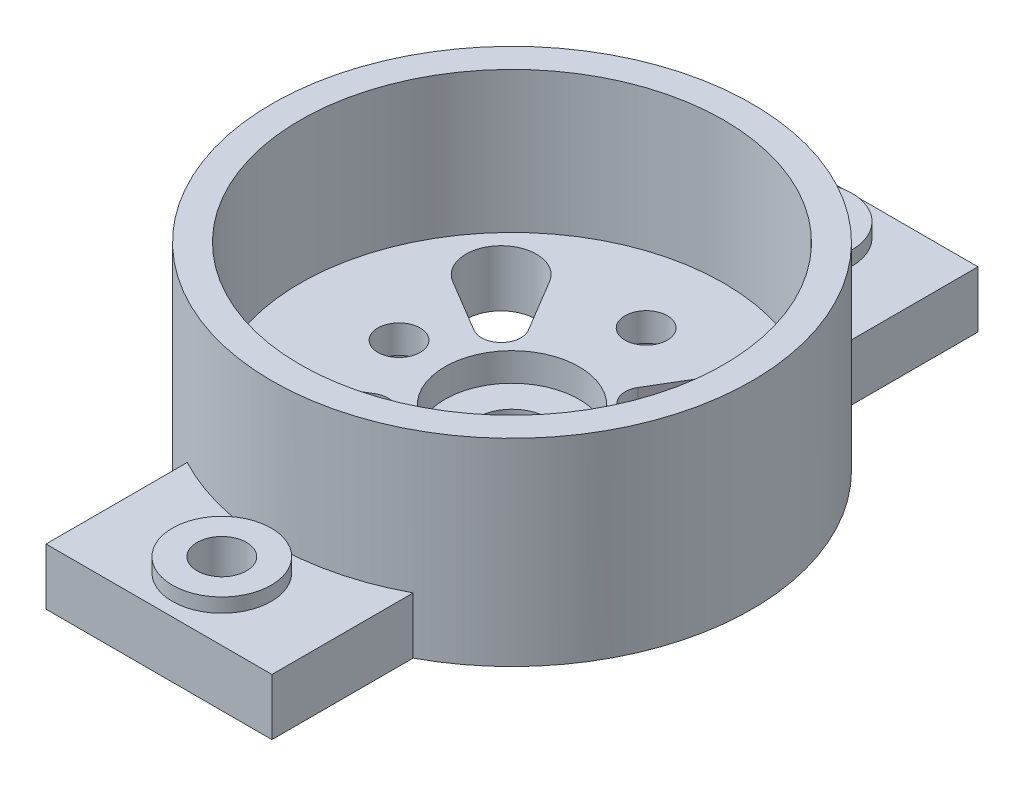
from build123d import *

# Parameters (mm, degrees)
ESTRUSIONE_ESTRUSIONE1_DEPTH = 4
SCHIZZO2_R                   = 17
SCHIZZO2_R_2                 = 15
ESTRUSIONE_ESTRUSIONE2_DEPTH = 10
SCHIZZO3_R                   = 2.5
SCHIZZO3_R_2                 = 1.5
TAGLIO_ESTRUSIONE1_DEPTH     = 32.843366656
SCHIZZO4_R                   = 4.75
TAGLIO_ESTRUSIONE2_DEPTH     = 2
SCHIZZO5_R                   = 2.5
TAGLIO_ESTRUSIONE3_DEPTH     = 2
SCHIZZO6_R                   = 3.5
ESTRUSIONE_ESTRUSIONE8_DEPTH = 1
SCHIZZO7_R                   = 1.75
TAGLIO_ESTRUSIONE4_DEPTH     = 32.543620591


with BuildPart() as part:
    # Schizzo1 → Estrusione-Estrusione1 (new body)
    with BuildSketch(Plane(origin=(0, 0, 0), x_dir=(1, 0, 0), z_dir=(0, 1, 0))):
        with BuildLine():
            Line((8, 25), (-8, 25))
            Line((-8, 25), (-8, 15))
            ThreePointArc((-8, 15), (-17, 0), (-8, -15))
            Line((-8, -15), (-8, -25))
            Line((-8, -25), (8, -25))
            Line((8, -25), (8, -15))
            ThreePointArc((8, -15), (17, 0), (8, 15))
            Line((8, 15), (8, 25))
        make_face()
    extrude(amount=ESTRUSIONE_ESTRUSIONE1_DEPTH)

    # Schizzo2 → Estrusione-Estrusione2 (add)
    with BuildSketch(Plane(origin=(0, 4, 0), x_dir=(1, 0, 0), z_dir=(0, 1, 0))):
        Circle(SCHIZZO2_R)
        Circle(SCHIZZO2_R_2, mode=Mode.SUBTRACT)
    extrude(amount=ESTRUSIONE_ESTRUSIONE2_DEPTH)

    # Schizzo3 → Taglio-Estrusione1 (cut, through all)
    with BuildSketch(Plane(origin=(0, 4, 0), x_dir=(1, 0, 0), z_dir=(0, 1, 0))):
        Circle(SCHIZZO3_R)
        with Locations((8, 0)):
            Circle(SCHIZZO3_R_2)
        with Locations((0, 9.5)):
            Circle(SCHIZZO3_R_2)
        with Locations((-8, 0)):
            Circle(SCHIZZO3_R_2)
        with Locations((0, -9.5)):
            Circle(SCHIZZO3_R_2)
        with BuildLine():
            Line((3.747842122, -5.667677506), (5.985468437, -9.413745909))
            ThreePointArc((5.985468437, -9.413745909), (9.899494937, -9.899494937), (9.413745909, -5.985468437))
            Line((9.413745909, -5.985468437), (5.667677506, -3.747842122))
            ThreePointArc((5.667677506, -3.747842122), (3.959797975, -3.959797975), (3.747842122, -5.667677506))
        make_face()
        with BuildLine():
            Line((-3.644139728, -6.051509987), (-5.881766043, -9.797578389))
            ThreePointArc((-5.881766043, -9.797578389), (-9.795792543, -10.283327417), (-9.310043515, -6.369300918))
            Line((-9.310043515, -6.369300918), (-5.563975112, -4.131674603))
            ThreePointArc((-5.563975112, -4.131674603), (-3.856095581, -4.343630455), (-3.644139728, -6.051509987))
        make_face()
        with BuildLine():
            Line((-5.947807593, 3.260307248), (-9.693875995, 5.497933563))
            ThreePointArc((-9.693875995, 5.497933563), (-10.179625023, 9.411960062), (-6.265598524, 8.926211034))
            Line((-6.265598524, 8.926211034), (-4.027972209, 5.180142632))
            ThreePointArc((-4.027972209, 5.180142632), (-4.239928061, 3.4722631), (-5.947807593, 3.260307248))
        make_face()
        with BuildLine():
            Line((3.364009642, 5.563975112), (5.601635957, 9.310043515))
            ThreePointArc((5.601635957, 9.310043515), (9.515662456, 9.795792543), (9.029913428, 5.881766043))
            Line((9.029913428, 5.881766043), (5.283845026, 3.644139728))
            ThreePointArc((5.283845026, 3.644139728), (3.575965494, 3.856095581), (3.364009642, 5.563975112))
        make_face()
    extrude(amount=-TAGLIO_ESTRUSIONE1_DEPTH, mode=Mode.SUBTRACT)

    # Schizzo4 → Taglio-Estrusione2 (cut)
    with BuildSketch(Plane(origin=(0, 4, 0), x_dir=(1, 0, 0), z_dir=(0, 1, 0))):
        Circle(SCHIZZO4_R)
    extrude(amount=-TAGLIO_ESTRUSIONE2_DEPTH, mode=Mode.SUBTRACT)

    # Schizzo5 → Taglio-Estrusione3 (cut)
    with BuildSketch(Plane.XZ):
        with Locations((-8, 0)):
            Circle(SCHIZZO5_R)
        with Locations((0, 9.5)):
            Circle(SCHIZZO5_R)
        with Locations((8, 0)):
            Circle(SCHIZZO5_R)
        with Locations((0, -9.5)):
            Circle(SCHIZZO5_R)
    extrude(amount=-TAGLIO_ESTRUSIONE3_DEPTH, mode=Mode.SUBTRACT)

    # Schizzo6 → Estrusione-Estrusione8 (add)
    with BuildSketch(Plane(origin=(0, 4, 0), x_dir=(1, 0, 0), z_dir=(0, 1, 0))):
        with Locations((0, 20.55)):
            Circle(SCHIZZO6_R)
        with Locations((0, -20.55)):
            Circle(SCHIZZO6_R)
    extrude(amount=ESTRUSIONE_ESTRUSIONE8_DEPTH)

    # Schizzo7 → Taglio-Estrusione4 (cut, through all)
    with BuildSketch(Plane(origin=(0, 5, 0), x_dir=(1, 0, 0), z_dir=(0, 1, 0))):
        with Locations((0, -20.55)):
            Circle(SCHIZZO7_R)
        with Locations((0, 20.55)):
            Circle(SCHIZZO7_R)
    extrude(amount=-TAGLIO_ESTRUSIONE4_DEPTH, mode=Mode.SUBTRACT)


solid = part.part
